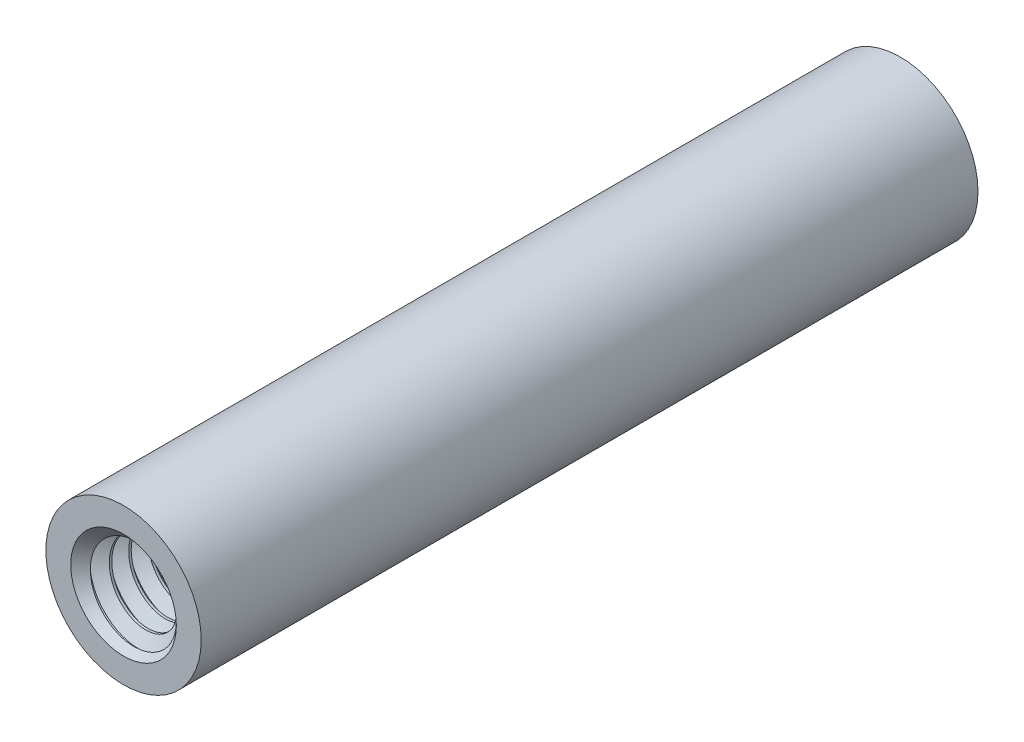
from build123d import *

# Parameters (mm, degrees)
BOSS_EXTRUDE1_START = 15.875
SKETCH13_R          = 2.0828
BOSS_EXTRUDE1_DEPTH = 11.1125
CUT_SWEEP1_PITCH    = 0.79375
CIRPATTERN1_COUNT   = 2
CIRPATTERN1_ANGLE   = 180
EXTRUDE1_DEPTH      = 15.875
EXTRUDE1_DEPTH_BACK = 15.875
SKETCH1_R           = 3.175


with BuildPart() as part:
    # Sketch13 → Boss-Extrude1 (new body)
    with BuildSketch(Plane.XY.offset(BOSS_EXTRUDE1_START)):
        Circle(SKETCH13_R)
    extrude(amount=-BOSS_EXTRUDE1_DEPTH)

    # Cut-Sweep1: the profile of Sketch15 profile screwed along a right-hand helix of 15 turns, 8 arcs to a turn; built about Z, then put on its axis
    cut_sweep1_z = Axis((0, 0, 0), (0, 0, 1))
    cut_sweep1_corners = [(2.0831, 0, -0.694704455), (2.0831, 0, 0.000173205), (1.567244252, 0, -0.29765625), (1.567244252, 0, -0.396875)]
    with BuildLine(mode=Mode.PRIVATE) as cut_sweep1_profile:
        Line(cut_sweep1_corners[0], cut_sweep1_corners[1])
        Line(cut_sweep1_corners[1], cut_sweep1_corners[2])
        Line(cut_sweep1_corners[2], cut_sweep1_corners[3])
        Line(cut_sweep1_corners[3], cut_sweep1_corners[0])
    cut_sweep1_cap = Face(cut_sweep1_profile.wire())
    cut_sweep1_turn_angles = [0, 22.5, 45, 67.5, 90, 112.5, 135, 157.5, 180, 202.5, 225, 247.5, 270, 292.5, 315, 337.5, 360]
    cut_sweep1_turn_weights = [1, 0.9238795325112867, 1, 0.9238795325112867, 1, 0.9238795325112867, 1, 0.9238795325112867, 1, 0.9238795325112867, 1, 0.9238795325112867, 1, 0.9238795325112867, 1, 0.9238795325112867, 1]
    cut_sweep1_turn_rails = [Edge.make_bspline([Vector(p[0], p[1], 0).rotate(cut_sweep1_z, cut_sweep1_turn_angles[k]) / cut_sweep1_turn_weights[k] + Vector(0, 0, p[2] + CUT_SWEEP1_PITCH * cut_sweep1_turn_angles[k] / 360) for k in range(17)], [0, 0, 0, 1, 1, 2, 2, 3, 3, 4, 4, 5, 5, 6, 6, 7, 7, 8, 8, 8], 2, cut_sweep1_turn_weights) for p in cut_sweep1_corners]
    cut_sweep1_turn_sides = [Face.make_surface_from_curves(cut_sweep1_turn_rails[p[0]], cut_sweep1_turn_rails[p[1]]) for p in [(0, 1), (1, 2), (2, 3), (3, 0)]]
    cut_sweep1 = Plane(origin=(0, 0, 15.875), x_dir=(0, 1, 0), z_dir=(0, 0, -1)) * Solid(Shell([*[p.moved(Location((0, 0, CUT_SWEEP1_PITCH * i))) for i in range(15) for p in cut_sweep1_turn_sides], cut_sweep1_cap, cut_sweep1_cap.rotate(cut_sweep1_z, 5400).moved(Location((0, 0, CUT_SWEEP1_PITCH * 5400 / 360)))]))
    add(cut_sweep1, mode=Mode.SUBTRACT)

    # Boss-Extrude2 cone 1 section (through the dimple's axis) → Boss-Extrude2 (revolve)
    with BuildSketch(Plane(origin=(0, 0, 15.875), x_dir=(0, -1, 0), z_dir=(1, 0, 0))):
        Polygon((0, 0), (2.159, 0), (0, 2.159), align=None)
    revolve(axis=Axis((0, 0, 15.875), (0, 0, -1)))


with BuildPart() as cirpattern1_1:
    # CirPattern1: pattern copy
    add(part.part.rotate(Axis((0, 3.175, 0), (0, -1, 0)), 1 * CIRPATTERN1_ANGLE / (CIRPATTERN1_COUNT - 1)))


with BuildPart() as body_3:
    # Sketch1 → Extrude1 (new, two sides: drawn at the far end of the back side and taken through both)
    with BuildSketch(Plane.XY.offset(-EXTRUDE1_DEPTH_BACK)):
        Circle(SKETCH1_R)
    extrude(amount=EXTRUDE1_DEPTH + EXTRUDE1_DEPTH_BACK)

    # Combine1: cut CirPattern1_1, part
    add(cirpattern1_1.part, mode=Mode.SUBTRACT)
    add(part.part, mode=Mode.SUBTRACT)


solid = body_3.part
